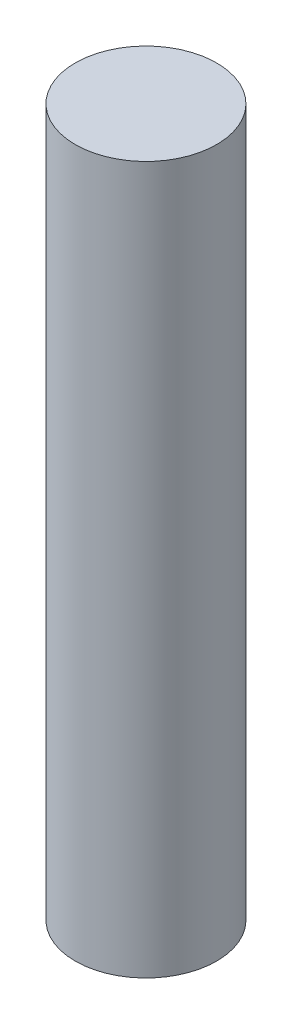
from build123d import *

# Parameters (mm, degrees)
SKETCH_1_R             = 5
EXTRUDE_1_DEPTH        = 50
HOLE_WIZARD_M4_1_D     = 3.3
HOLE_WIZARD_M4_1_DEPTH = 15
HOLE_WIZARD_M4_1_TIP   = 0.991420021


with BuildPart() as part:
    # 草图1 → 凸台-拉伸1 (new body)
    with BuildSketch(Plane(origin=(0, 0, 0), x_dir=(1, 0, 0), z_dir=(0, 1, 0))):
        Circle(SKETCH_1_R)
    extrude(amount=EXTRUDE_1_DEPTH)

    # M4 螺纹孔1
    with Locations(Plane(origin=(0, 0, 0), x_dir=(-1, 0, 0), z_dir=(0, -1, 0))):
        with Locations((0, 0)):
            Hole(HOLE_WIZARD_M4_1_D / 2, depth=HOLE_WIZARD_M4_1_DEPTH)
            with Locations((0, 0, -(HOLE_WIZARD_M4_1_DEPTH + HOLE_WIZARD_M4_1_TIP / 2))):  # 118° drill point
                Cone(0, HOLE_WIZARD_M4_1_D / 2, HOLE_WIZARD_M4_1_TIP, mode=Mode.SUBTRACT)


solid = part.part
